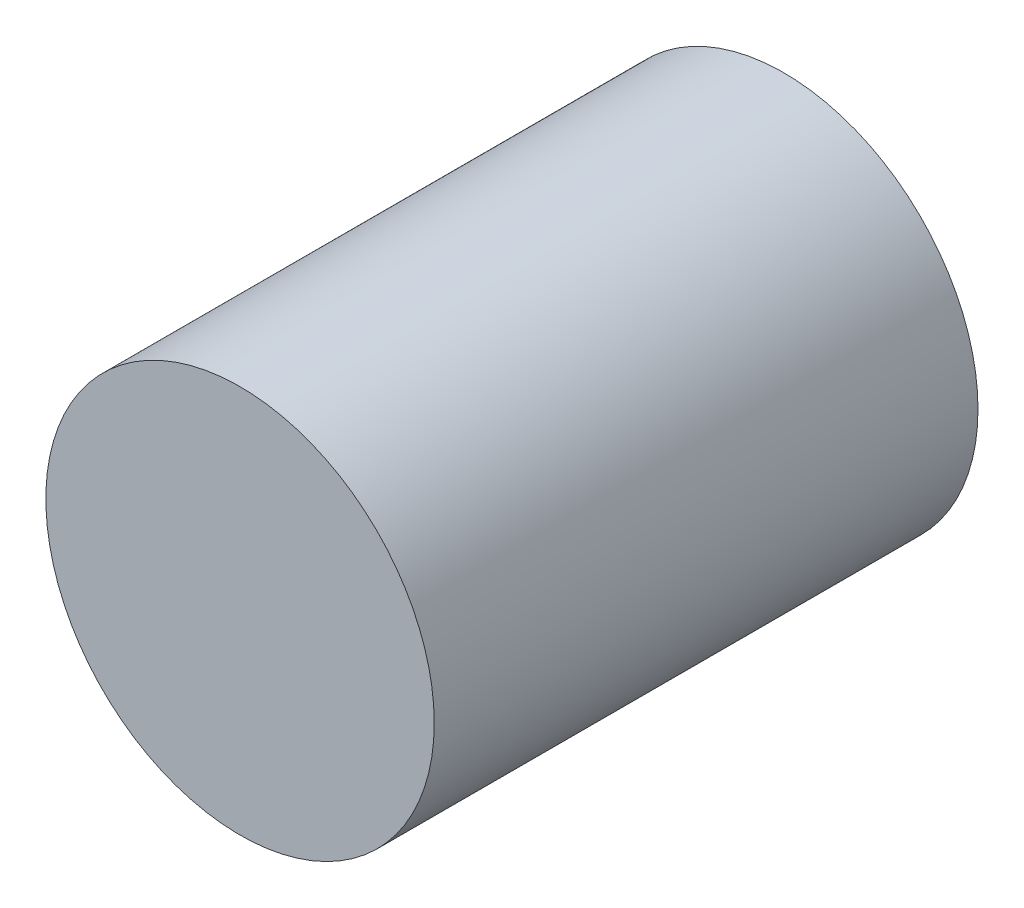
from build123d import *

# Parameters (mm, degrees)
SKETCH1_R           = 10
BOSS_EXTRUDE1_DEPTH = 28


with BuildPart() as part:
    # Sketch1 → Boss-Extrude1 (new body)
    with BuildSketch(Plane.XY):
        Circle(SKETCH1_R)
    extrude(amount=BOSS_EXTRUDE1_DEPTH)


solid = part.part
